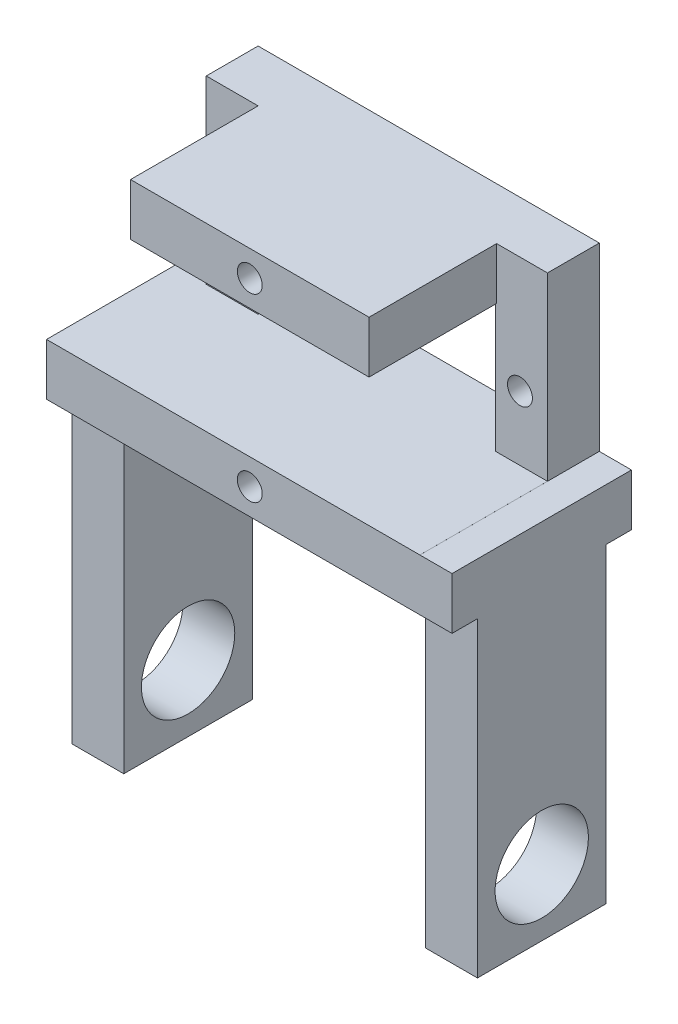
from build123d import *

# Parameters (mm, degrees)
SKETCH1_W           = 32.9
SKETCH1_H           = 22.4
BOSS_EXTRUDE1_DEPTH = 5
SKETCH2_R           = 1.2
SKETCH2_W           = 22.9
SKETCH2_H           = 12.4
CUT_EXTRUDE2_DEPTH  = 5
SKETCH3_W           = 22.996888994
SKETCH3_H           = 5
BOSS_EXTRUDE2_DEPTH = 12.3
SKETCH4_R           = 1.2
CUT_EXTRUDE3_DEPTH  = 5
SKETCH6_W           = 5
SKETCH6_H           = 5
SKETCH6_W_2         = 4.903111006
BOSS_EXTRUDE3_DEPTH = 12.3
SKETCH8_W           = 17.3
SKETCH8_H           = 4.998204887
BOSS_EXTRUDE4_DEPTH = 3.1
SKETCH9_W           = 17.3
SKETCH9_H           = 5
BOSS_EXTRUDE5_DEPTH = 3.1
SKETCH18_W          = 5
SKETCH18_H          = 12.4
BOSS_EXTRUDE7_DEPTH = 30
SKETCH19_R          = 4.5
CUT_EXTRUDE6_DEPTH  = 30
CUT_EXTRUDE7_START  = -30
SKETCH20_R          = 4.5
CUT_EXTRUDE7_DEPTH  = 30
SKETCH10_W          = 5
SKETCH10_H          = 12.4
BOSS_EXTRUDE6_DEPTH = 30
SKETCH21_R          = 4.5
CUT_EXTRUDE8_DEPTH  = 10
SKETCH22_R          = 4.5
CUT_EXTRUDE9_DEPTH  = 10


with BuildPart() as part:
    # Sketch1 → Boss-Extrude1 (new body)
    with BuildSketch(Plane.XY):
        Rectangle(SKETCH1_W, SKETCH1_H)
    extrude(amount=BOSS_EXTRUDE1_DEPTH)

    # Sketch2 → Cut-Extrude2 (cut)
    with BuildSketch(Plane.XY.offset(5)):
        with Locations((13.8, 0)):
            Circle(SKETCH2_R)
        with Locations((-13.8, 0)):
            Circle(SKETCH2_R)
        Rectangle(SKETCH2_W, SKETCH2_H)
    extrude(amount=-CUT_EXTRUDE2_DEPTH, mode=Mode.SUBTRACT)

    # Sketch3 → Boss-Extrude2 (add)
    with BuildSketch(Plane.XY.offset(5)):
        with Locations((0.048444497, 8.7)):
            Rectangle(SKETCH3_W, SKETCH3_H)
        with Locations((0.048444497, -8.7)):
            Rectangle(SKETCH3_W, SKETCH3_H)
    extrude(amount=BOSS_EXTRUDE2_DEPTH)

    # Sketch4 → Cut-Extrude3 (cut)
    with BuildSketch(Plane.XY.offset(17.3)):
        with Locations((0.048444497, 8.7)):
            Circle(SKETCH4_R)
        with Locations((0.048444497, -8.7)):
            Circle(SKETCH4_R)
    extrude(amount=-CUT_EXTRUDE3_DEPTH, mode=Mode.SUBTRACT)

    # Sketch6 → Boss-Extrude3 (add)
    with BuildSketch(Plane.XY.offset(5)):
        with Locations((-13.95, -8.7)):
            Rectangle(SKETCH6_W, SKETCH6_H)
        with Locations((13.998444497, -8.7)):
            Rectangle(SKETCH6_W_2, SKETCH6_H)
    extrude(amount=BOSS_EXTRUDE3_DEPTH)

    # Sketch8 → Boss-Extrude4 (add)
    with BuildSketch(Plane(origin=(16.45, 0, 0), x_dir=(0, 0, -1), z_dir=(1, 0, 0))):
        with Locations((-8.65, -8.700897557)):
            Rectangle(SKETCH8_W, SKETCH8_H)
    extrude(amount=BOSS_EXTRUDE4_DEPTH)

    # Sketch9 → Boss-Extrude5 (add)
    with BuildSketch(Plane.ZY.offset(16.45)):
        with Locations((8.65, -8.7)):
            Rectangle(SKETCH9_W, SKETCH9_H)
    extrude(amount=BOSS_EXTRUDE5_DEPTH)

    # Sketch18 → Boss-Extrude7 (add)
    with BuildSketch(Plane.XZ.offset(11.2)):
        with Locations((-17.05, 8.65)):
            Rectangle(SKETCH18_W, SKETCH18_H)
        with Locations((17.05, 8.65)):
            Rectangle(SKETCH18_W, SKETCH18_H)
    extrude(amount=BOSS_EXTRUDE7_DEPTH)

    # Sketch19 → Cut-Extrude6 (cut)
    with BuildSketch(Plane.ZY.offset(19.55)):
        with Locations((8.65, -34.8)):
            Circle(SKETCH19_R)
    extrude(amount=-CUT_EXTRUDE6_DEPTH, mode=Mode.SUBTRACT)

    # Sketch20 → Cut-Extrude7 (cut)
    with BuildSketch(Plane(origin=(19.55, 0, 0), x_dir=(0, 0, -1), z_dir=(1, 0, 0)).offset(CUT_EXTRUDE7_START)):
        with Locations((-8.65, -34.8)):
            Circle(SKETCH20_R)
    extrude(amount=CUT_EXTRUDE7_DEPTH, mode=Mode.SUBTRACT)

    # Sketch10 → Boss-Extrude6 (add)
    with BuildSketch(Plane.XZ.offset(11.2)):
        with Locations((17.05, 8.65)):
            Rectangle(SKETCH10_W, SKETCH10_H)
        with Locations((-17.05, 8.65)):
            Rectangle(SKETCH10_W, SKETCH10_H)
    extrude(amount=BOSS_EXTRUDE6_DEPTH)

    # Sketch21 → Cut-Extrude8 (cut)
    with BuildSketch(Plane(origin=(19.55, 0, 0), x_dir=(0, 0, -1), z_dir=(1, 0, 0))):
        with Locations((-8.65, -34.8)):
            Circle(SKETCH21_R)
    extrude(amount=-CUT_EXTRUDE8_DEPTH, mode=Mode.SUBTRACT)

    # Sketch22 → Cut-Extrude9 (cut)
    with BuildSketch(Plane(origin=(-14.55, 0, 0), x_dir=(0, 0, -1), z_dir=(1, 0, 0))):
        with Locations((-8.65, -34.8)):
            Circle(SKETCH22_R)
    extrude(amount=-CUT_EXTRUDE9_DEPTH, mode=Mode.SUBTRACT)


solid = part.part
